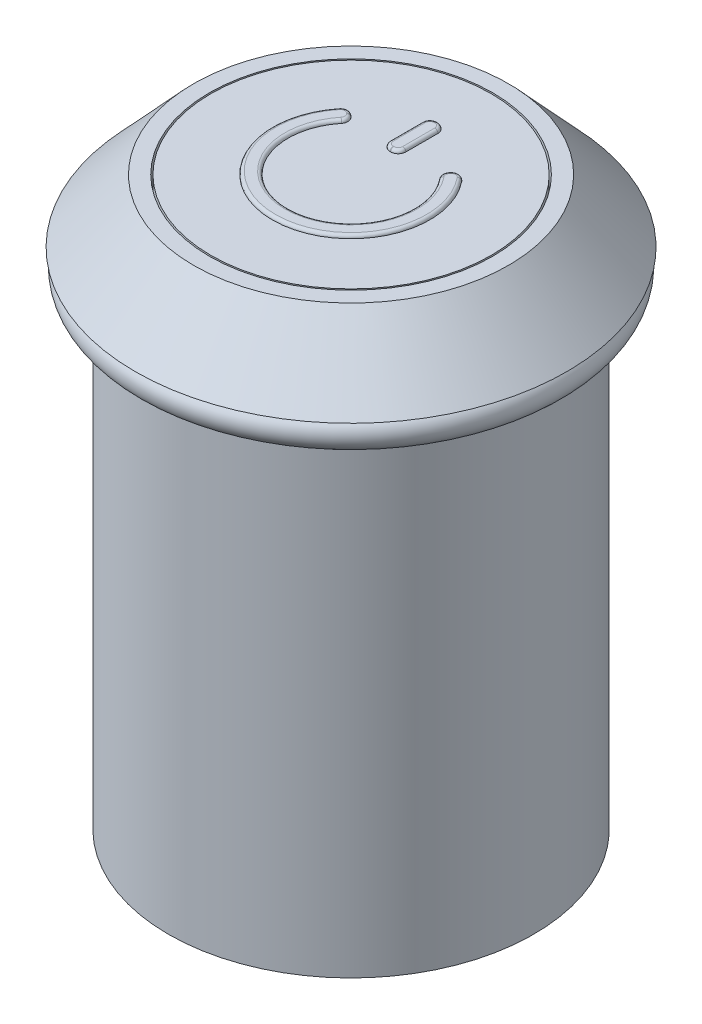
from build123d import *

# Parameters (mm, degrees)
SKETCH1_R           = 5.8
BOSS_EXTRUDE1_DEPTH = 16
SKETCH3_R           = 5
SKETCH2_R           = 6.85
SKETCH4_R           = 4.5
CUT_EXTRUDE1_DEPTH  = 3
SKETCH6_R           = 4.45
BOSS_EXTRUDE2_DEPTH = 3
BOSS_EXTRUDE3_DEPTH = 0.1
FILLET1_R           = 0.1
SKETCH8_R           = 0.5


with BuildPart() as part:
    # Sketch1 → Boss-Extrude1 (new body)
    with BuildSketch(Plane(origin=(0, 0, 0), x_dir=(1, 0, 0), z_dir=(0, 1, 0))):
        with Locations(Location((0, 0, 0), (0, 0, 270))):
            Circle(SKETCH1_R)
    extrude(amount=BOSS_EXTRUDE1_DEPTH)

    # Sketch3 → Loft1 section 0
    with BuildSketch(Plane(origin=(0, 18, 0), x_dir=(1, 0, 0), z_dir=(0, 1, 0))):
        Circle(SKETCH3_R)
    # Sketch2 → Loft1 section 1
    with BuildSketch(Plane(origin=(0, 16, 0), x_dir=(1, 0, 0), z_dir=(0, 1, 0))):
        Circle(SKETCH2_R)
    loft()

    # Sketch4 → Cut-Extrude1 (cut)
    with BuildSketch(Plane(origin=(0, 18, 0), x_dir=(1, 0, 0), z_dir=(0, 1, 0))):
        with Locations(Location((0, 0, 0), (0, 0, 270))):
            Circle(SKETCH4_R)
    extrude(amount=-CUT_EXTRUDE1_DEPTH, mode=Mode.SUBTRACT)

    # Sketch6 → Boss-Extrude2 (add)
    with BuildSketch(Plane(origin=(0, 15, 0), x_dir=(1, 0, 0), z_dir=(0, 1, 0))):
        with Locations(Location((0, 0, 0), (0, 0, 270))):
            Circle(SKETCH6_R)
    extrude(amount=BOSS_EXTRUDE2_DEPTH)

    # Sketch7 → Boss-Extrude3 (add)
    with BuildSketch(Plane(origin=(0, 18, 0), x_dir=(1, 0, 0), z_dir=(0, 1, 0))):
        with BuildLine():
            Line((-1.589024858, 1.589024858), (-1.574801575, 1.574801575))
            ThreePointArc((-1.574801575, 1.574801575), (-1.504852833, 1.417971633), (-1.557595716, 1.254549953))
            ThreePointArc((-1.557595716, 1.254549953), (0, -2), (1.557595716, 1.254549953))
            ThreePointArc((1.557595716, 1.254549953), (1.504852833, 1.417971633), (1.574801575, 1.574801575))
            Line((1.574801575, 1.574801575), (1.589024858, 1.589024858))
            ThreePointArc((1.589024858, 1.589024858), (1.771491902, 1.658979712), (1.945498325, 1.570043397))
            ThreePointArc((1.945498325, 1.570043397), (0, -2.5), (-1.945498325, 1.570043397))
            ThreePointArc((-1.945498325, 1.570043397), (-1.771491902, 1.658979712), (-1.589024858, 1.589024858))
        make_face()
        with BuildLine():
            Line((-0.01, 2.75), (0.01, 2.75))
            ThreePointArc((0.01, 2.75), (0.179705627, 2.679705627), (0.25, 2.51))
            Line((0.25, 2.51), (0.25, 1.49))
            ThreePointArc((0.25, 1.49), (0.179705627, 1.320294373), (0.01, 1.25))
            Line((0.01, 1.25), (-0.01, 1.25))
            ThreePointArc((-0.01, 1.25), (-0.179705627, 1.320294373), (-0.25, 1.49))
            Line((-0.25, 1.49), (-0.25, 2.51))
            ThreePointArc((-0.25, 2.51), (-0.179705627, 2.679705627), (-0.01, 2.75))
        make_face()
    extrude(amount=BOSS_EXTRUDE3_DEPTH)

    # Fillet1
    fillet1_edges = [part.edges().sort_by_distance(p)[0] for p in [
        (-1.771491902, 18.1, -1.658979712),
        (-1.581913217, 18.1, -1.581913217),
        (-1.504852833, 18.1, -1.417971633),
        (0, 18.1, 2),
        (1.504852833, 18.1, -1.417971633),
        (1.581913217, 18.1, -1.581913217),
        (1.771491902, 18.1, -1.658979712),
        (-0.25, 18.1, -2),
        (-0.179705627, 18.1, -2.679705627),
        (0, 18.1, -2.75),
        (0.179705627, 18.1, -2.679705627),
        (0.25, 18.1, -2),
        (0.179705627, 18.1, -1.320294373),
        (0, 18.1, -1.25),
        (-0.179705627, 18.1, -1.320294373),
        (0, 18.1, 2.5),
    ]]
    fillet(fillet1_edges, radius=FILLET1_R - 0.0001)  # a hair under: the kernel refuses the full size


with BuildPart() as body_2:
    # Sketch8 → Revolve1 (revolve)
    with BuildSketch(Plane.XY, mode=Mode.PRIVATE) as revolve1_sk:
        with Locations((-6.3, 15.5)):
            Circle(SKETCH8_R)
    revolve(revolve1_sk.sketch.rotate(Axis((0, 16, 0), (0, 1, 0)), 90), axis=Axis((0, 16, 0), (0, 1, 0)))


solid = Compound([part.part, body_2.part])
